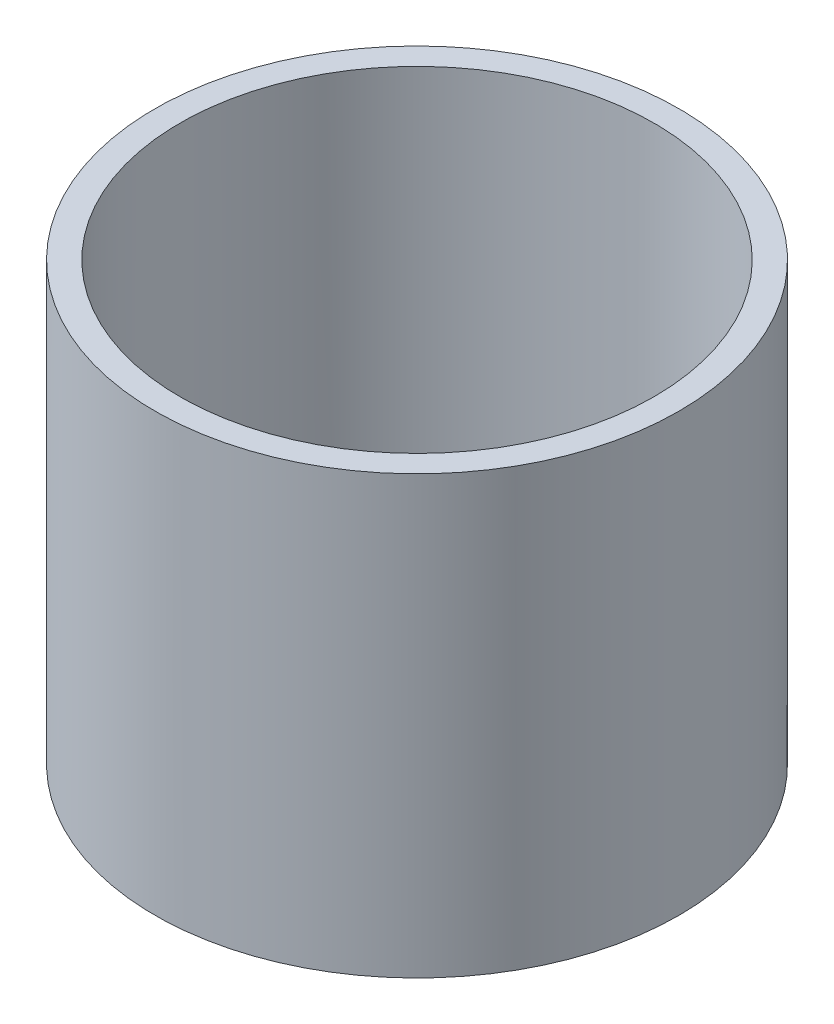
from build123d import *


with BuildPart() as part:
    # Sketch2 → Revolve2 (revolve)
    with BuildSketch(Plane.XY):
        Polygon((21, 35), (21, 0), (6.5, -5.277568397), (4.5, -5.277568397), (19, 0), (19, 35), align=None)
    revolve(axis=Axis((0, -1000, 0), (0, 1, 0)))


solid = part.part
